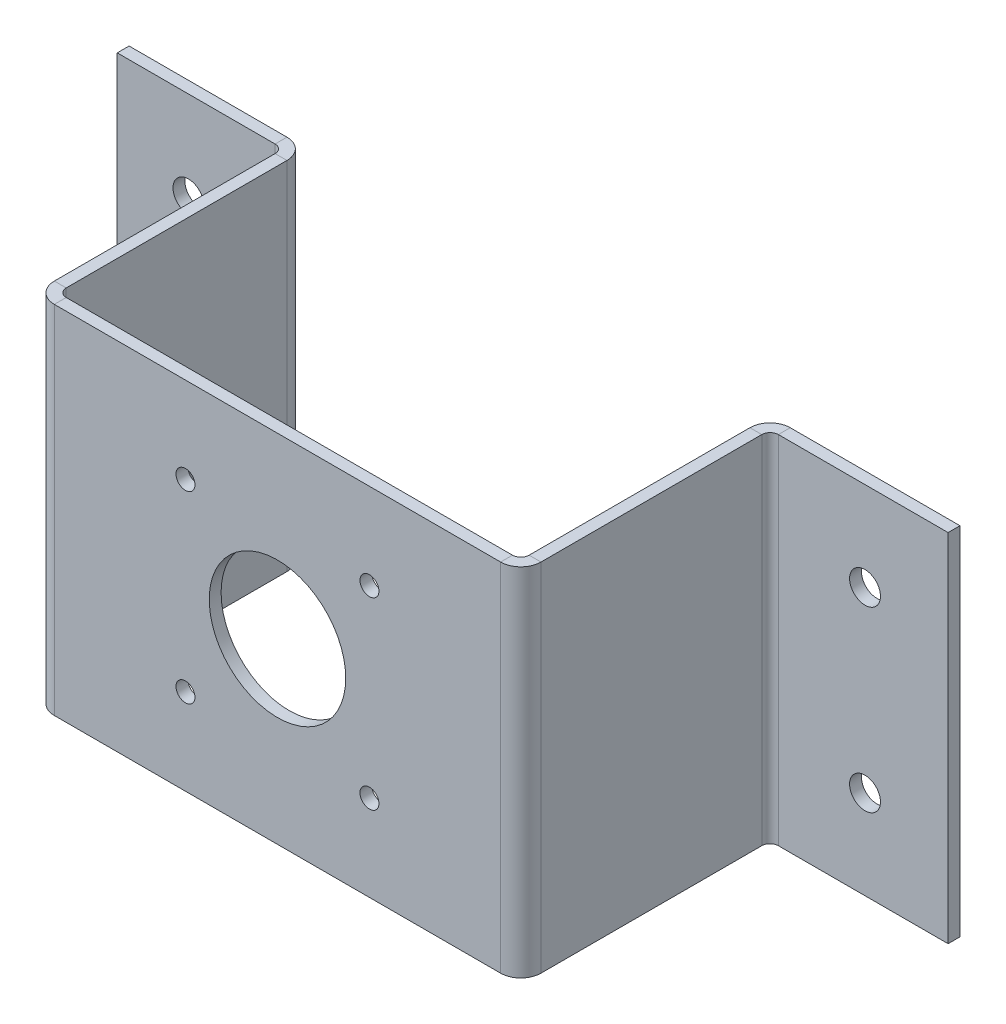
from build123d import *

# Parameters (mm, degrees)
SKETCH1_W                    = 30
SKETCH1_H                    = 60
BASE_FLANGE1_DEPTH           = 2
EDGE_FLANGE1_STRIP_W         = 12.8
EDGE_FLANGE1_STRIP_H         = 2
EDGE_FLANGE1_STRIP_CUT_DEPTH = 60
EDGE_FLANGE1_DEPTH           = 60
EDGE_FLANGE2_STRIP_W         = 12.8
EDGE_FLANGE2_STRIP_H         = 2
EDGE_FLANGE2_STRIP_CUT_DEPTH = 60
EDGE_FLANGE2_DEPTH           = 60
EDGE_FLANGE3_STRIP_W         = 12.8
EDGE_FLANGE3_STRIP_H         = 2
EDGE_FLANGE3_STRIP_CUT_DEPTH = 60
EDGE_FLANGE3_DEPTH           = 60
EDGE_FLANGE4_STRIP_W         = 12.8
EDGE_FLANGE4_STRIP_H         = 2
EDGE_FLANGE4_STRIP_CUT_DEPTH = 60
EDGE_FLANGE4_DEPTH           = 60
SKETCH22_R                   = 2.6
CUT_EXTRUDE1_DEPTH           = 133.800602408
SKETCH23_R                   = 11.5
SKETCH23_R_2                 = 1.6
CUT_EXTRUDE2_DEPTH           = 5


# Sheet-metal steps are written as plain solids
with BuildPart() as part:
    # Sketch1 → Base-Flange1 (new body)
    with BuildSketch(Plane.XY):
        with Locations((15, 30)):
            Rectangle(SKETCH1_W, SKETCH1_H)
    extrude(amount=-BASE_FLANGE1_DEPTH)

    # Edge-Flange1 strip (across the edge) → Edge-Flange1 strip cut (cut)
    with BuildSketch(Plane(origin=(-2, 60, 0), x_dir=(1, 0, 0), z_dir=(0, -1, 0))):
        with Locations((-3, -1)):
            Rectangle(EDGE_FLANGE1_STRIP_W, EDGE_FLANGE1_STRIP_H)
    extrude(amount=EDGE_FLANGE1_STRIP_CUT_DEPTH, mode=Mode.SUBTRACT)

    # Edge-Flange1 section (across the edge) → Edge-Flange1 (add)
    with BuildSketch(Plane(origin=(-2, 60, 0), x_dir=(1, 0, 0), z_dir=(0, -1, 0))):
        with BuildLine():
            Line((0, 1.4), (0, 40))
            Line((0, 40), (2, 40))
            Line((2, 40), (2, 1.4))
            ThreePointArc((2, 1.4), (2.410050506, 0.410050506), (3.4, 0))
            Line((3.4, 0), (3.4, -2))
            ThreePointArc((3.4, -2), (0.995836944, -1.004163056), (0, 1.4))
        make_face()
    extrude(amount=EDGE_FLANGE1_DEPTH)

    # Edge-Flange2 strip (across the edge) → Edge-Flange2 strip cut (cut)
    with BuildSketch(Plane(origin=(-2, 0, 42), x_dir=(0, 0, -1), z_dir=(0, 1, 0))):
        with Locations((-3, -1)):
            Rectangle(EDGE_FLANGE2_STRIP_W, EDGE_FLANGE2_STRIP_H)
    extrude(amount=EDGE_FLANGE2_STRIP_CUT_DEPTH, mode=Mode.SUBTRACT)

    # Edge-Flange2 section (across the edge) → Edge-Flange2 (add)
    with BuildSketch(Plane(origin=(-2, 0, 42), x_dir=(0, 0, -1), z_dir=(0, 1, 0))):
        with BuildLine():
            Line((0, 1.4), (0, 78))
            Line((0, 78), (2, 78))
            Line((2, 78), (2, 1.4))
            ThreePointArc((2, 1.4), (2.410050506, 0.410050506), (3.4, 0))
            Line((3.4, 0), (3.4, -2))
            ThreePointArc((3.4, -2), (0.995836944, -1.004163056), (0, 1.4))
        make_face()
    extrude(amount=EDGE_FLANGE2_DEPTH)

    # Edge-Flange3 strip (across the edge) → Edge-Flange3 strip cut (cut)
    with BuildSketch(Plane(origin=(-82, 0, 40), x_dir=(1, 0, 0), z_dir=(0, 1, 0))):
        with Locations((-3, -1)):
            Rectangle(EDGE_FLANGE3_STRIP_W, EDGE_FLANGE3_STRIP_H)
    extrude(amount=EDGE_FLANGE3_STRIP_CUT_DEPTH, mode=Mode.SUBTRACT)

    # Edge-Flange3 section (across the edge) → Edge-Flange3 (add)
    with BuildSketch(Plane(origin=(-82, 0, 40), x_dir=(1, 0, 0), z_dir=(0, 1, 0))):
        with BuildLine():
            Line((0, 1.4), (0, 40))
            Line((0, 40), (2, 40))
            Line((2, 40), (2, 1.4))
            ThreePointArc((2, 1.4), (2.410050506, 0.410050506), (3.4, 0))
            Line((3.4, 0), (3.4, -2))
            ThreePointArc((3.4, -2), (0.995836944, -1.004163056), (0, 1.4))
        make_face()
    extrude(amount=EDGE_FLANGE3_DEPTH)

    # Edge-Flange4 strip (across the edge) → Edge-Flange4 strip cut (cut)
    with BuildSketch(Plane(origin=(-82, 60, -2), x_dir=(0, 0, 1), z_dir=(0, -1, 0))):
        with Locations((-3, -1)):
            Rectangle(EDGE_FLANGE4_STRIP_W, EDGE_FLANGE4_STRIP_H)
    extrude(amount=EDGE_FLANGE4_STRIP_CUT_DEPTH, mode=Mode.SUBTRACT)

    # Edge-Flange4 section (across the edge) → Edge-Flange4 (add)
    with BuildSketch(Plane(origin=(-82, 60, -2), x_dir=(0, 0, 1), z_dir=(0, -1, 0))):
        with BuildLine():
            Line((0, 1.4), (0, 28))
            Line((0, 28), (2, 28))
            Line((2, 28), (2, 1.4))
            ThreePointArc((2, 1.4), (2.410050506, 0.410050506), (3.4, 0))
            Line((3.4, 0), (3.4, -2))
            ThreePointArc((3.4, -2), (0.995836944, -1.004163056), (0, 1.4))
        make_face()
    extrude(amount=EDGE_FLANGE4_DEPTH)

    # Sketch22 → Cut-Extrude1 (cut, through all)
    with BuildSketch(Plane(origin=(0, 0, -2), x_dir=(-1, 0, 0), z_dir=(0, 0, -1))):
        with Locations((-16, 45)):
            Circle(SKETCH22_R)
        with Locations((-16, 15)):
            Circle(SKETCH22_R)
        with Locations((98, 45)):
            Circle(SKETCH22_R)
        with Locations((98, 15)):
            Circle(SKETCH22_R)
    extrude(amount=-CUT_EXTRUDE1_DEPTH, mode=Mode.SUBTRACT)

    # Sketch23 → Cut-Extrude2 (cut)
    with BuildSketch(Plane.XY.offset(42)):
        with Locations((-41, 30)):
            Circle(SKETCH23_R)
        with Locations((-25.5, 45.5)):
            Circle(SKETCH23_R_2)
        with Locations((-25.5, 14.5)):
            Circle(SKETCH23_R_2)
        with Locations((-56.5, 14.5)):
            Circle(SKETCH23_R_2)
        with Locations((-56.5, 45.5)):
            Circle(SKETCH23_R_2)
    extrude(amount=-CUT_EXTRUDE2_DEPTH, mode=Mode.SUBTRACT)


solid = part.part
